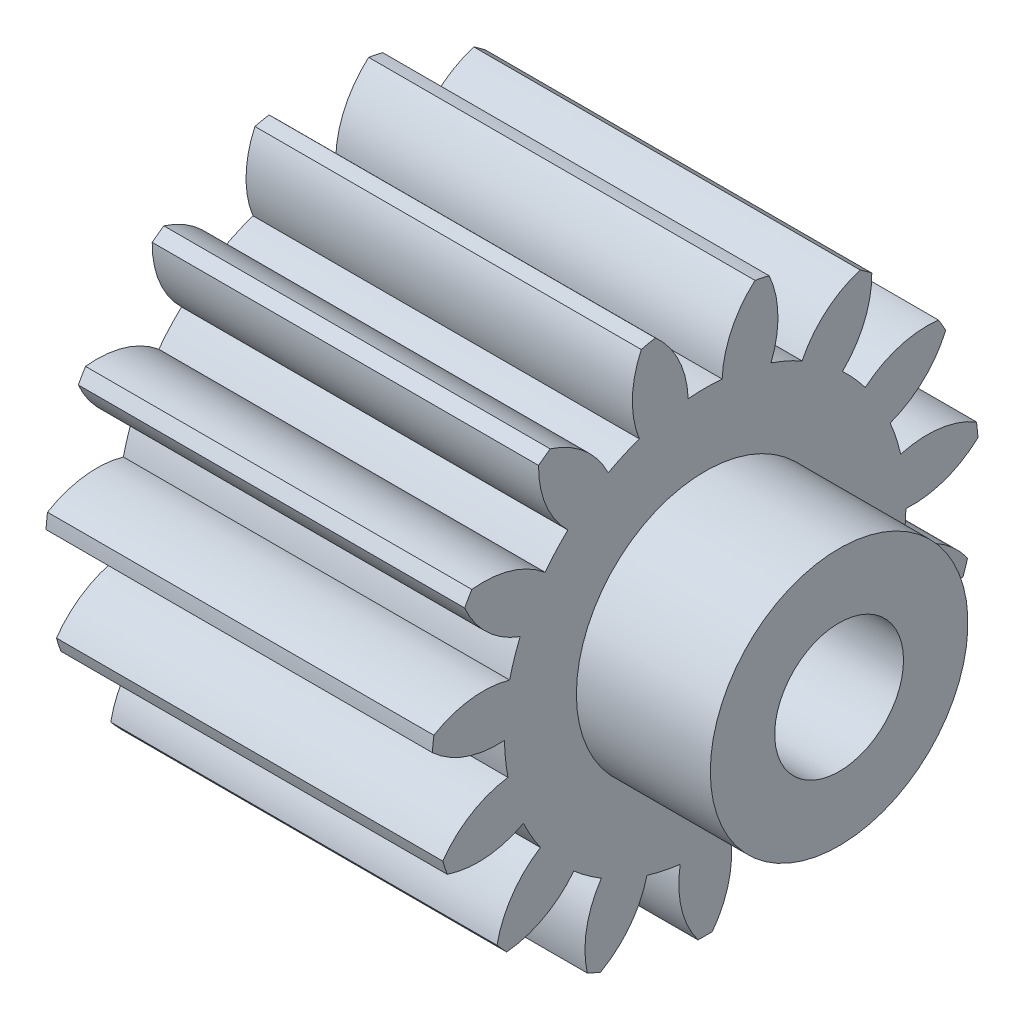
from build123d import *

# Parameters (mm, degrees)
SPUR_START             = -77.326171545
SPUR_GEAR_AI_OUTLINE_R = 1.5875
SPUR_GEAR_AI_DEPTH     = 9.525
SKETCH1_R              = 3.175
SKETCH1_R_2            = 1.5875
BOSS_EXTRUDE1_DEPTH    = 3.302


# Read off the part's stored shape, not the designer's step: spur gear_ai
with BuildPart() as part:
    # spur gear_ai outline → spur gear_ai (new body)
    with BuildSketch(Plane.YZ.offset(SPUR_START)):
        with BuildLine():
            ThreePointArc((25.700043696, 22.871890839), (25.806291245, 23.014153087), (25.908758385, 23.159161964))
            ThreePointArc((25.908758385, 23.159161964), (25.44365934, 24.001503635), (24.683177407, 24.591015164))
            ThreePointArc((24.683177407, 24.591015164), (24.869844856, 24.966591507), (25.024047568, 25.356622082))
            ThreePointArc((25.024047568, 25.356622082), (25.971001747, 25.185934076), (26.908195608, 25.40393472))
            ThreePointArc((26.908195608, 25.40393472), (26.947394305, 25.577112523), (26.982022272, 25.751261864))
            ThreePointArc((26.982022272, 25.751261864), (26.214521927, 26.331606447), (25.280011171, 26.560836158))
            ThreePointArc((25.280011171, 26.560836158), (25.297779711, 26.979866711), (25.280011171, 27.398897265))
            ThreePointArc((25.280011171, 27.398897265), (26.214521927, 27.628126976), (26.982022272, 28.208471559))
            ThreePointArc((26.982022272, 28.208471559), (26.947394305, 28.3826209), (26.908195608, 28.555798703))
            ThreePointArc((26.908195608, 28.555798703), (25.971001747, 28.773799347), (25.024047568, 28.60311134))
            ThreePointArc((25.024047568, 28.60311134), (24.869844856, 28.993141915), (24.683177407, 29.368718258))
            ThreePointArc((24.683177407, 29.368718258), (25.44365934, 29.958229787), (25.908758385, 30.800571458))
            ThreePointArc((25.908758385, 30.800571458), (25.806291245, 30.945580335), (25.700043696, 31.087842584))
            ThreePointArc((25.700043696, 31.087842584), (24.755205651, 30.905804997), (23.959545029, 30.36471278))
            ThreePointArc((23.959545029, 30.36471278), (23.660034115, 30.658303547), (23.336744253, 30.925485117))
            ThreePointArc((23.336744253, 30.925485117), (23.791703129, 31.773346565), (23.873981026, 32.732036797))
            ThreePointArc((23.873981026, 32.732036797), (23.721392211, 32.822831857), (23.566466975, 32.909580117))
            ThreePointArc((23.566466975, 32.909580117), (22.777355829, 32.358980252), (22.270565713, 31.541043584))
            ThreePointArc((22.270565713, 31.541043584), (21.877534755, 31.687430032), (21.473522236, 31.800018709))
            ThreePointArc((21.473522236, 31.800018709), (21.544291531, 32.759627129), (21.229521683, 33.668899671))
            ThreePointArc((21.229521683, 33.668899671), (21.053195187, 33.689781624), (20.876380246, 33.706016332))
            ThreePointArc((20.876380246, 33.706016332), (20.379440483, 32.882057908), (20.249149489, 31.92870547))
            ThreePointArc((20.249149489, 31.92870547), (19.83055711, 31.902576052), (19.415679368, 31.84110423))
            ThreePointArc((19.415679368, 31.84110423), (19.090022428, 32.746534609), (18.432631403, 33.449167979))
            ThreePointArc((18.432631403, 33.449167979), (18.263055677, 33.396526145), (18.09492394, 33.339440173))
            ThreePointArc((18.09492394, 33.339440173), (17.976080961, 32.384593086), (18.244817586, 31.460668176))
            ThreePointArc((18.244817586, 31.460668176), (17.873042211, 31.266540906), (17.519035377, 31.041637622))
            ThreePointArc((17.519035377, 31.041637622), (16.853261246, 31.736332821), (15.966917922, 32.110835325))
            ThreePointArc((15.966917922, 32.110835325), (15.833414151, 31.993771955), (15.703037123, 31.873235987))
            ThreePointArc((15.703037123, 31.873235987), (15.982839958, 30.952601973), (16.604137198, 30.217859601))
            ThreePointArc((16.604137198, 30.217859601), (16.343462167, 29.889300848), (16.111537238, 29.539853923))
            ThreePointArc((16.111537238, 29.539853923), (15.220764312, 29.903694832), (14.258725503, 29.885311585))
            ThreePointArc((14.258725503, 29.885311585), (14.184377702, 29.724068), (14.114298755, 29.560923799))
            ThreePointArc((14.114298755, 29.560923799), (14.744366952, 28.833688843), (15.610796869, 28.41517264))
            ThreePointArc((15.610796869, 28.41517264), (15.506295264, 28.008993196), (15.436554167, 27.595425178))
            ThreePointArc((15.436554167, 27.595425178), (14.474805177, 27.565500398), (13.603416133, 27.157410031))
            ThreePointArc((13.603416133, 27.157410031), (13.601079711, 26.979866712), (13.603416133, 26.802323392))
            ThreePointArc((13.603416133, 26.802323392), (14.474805177, 26.394233025), (15.436554167, 26.364308244))
            ThreePointArc((15.436554167, 26.364308244), (15.506295264, 25.950740226), (15.610796869, 25.544560783))
            ThreePointArc((15.610796869, 25.544560783), (14.744366952, 25.12604458), (14.114298755, 24.398809624))
            ThreePointArc((14.114298755, 24.398809624), (14.184377702, 24.235665423), (14.258725503, 24.074421838))
            ThreePointArc((14.258725503, 24.074421838), (15.220764312, 24.056038591), (16.111537238, 24.4198795))
            ThreePointArc((16.111537238, 24.4198795), (16.343462167, 24.070432575), (16.604137198, 23.741873821))
            ThreePointArc((16.604137198, 23.741873821), (15.982839958, 23.007131449), (15.703037123, 22.086497436))
            ThreePointArc((15.703037123, 22.086497436), (15.833414152, 21.965961467), (15.966917922, 21.848898097))
            ThreePointArc((15.966917922, 21.848898097), (16.853261246, 22.223400602), (17.519035377, 22.918095801))
            ThreePointArc((17.519035377, 22.918095801), (17.873042211, 22.693192517), (18.244817586, 22.499065247))
            ThreePointArc((18.244817586, 22.499065247), (17.976080961, 21.575140337), (18.09492394, 20.62029325))
            ThreePointArc((18.09492394, 20.62029325), (18.263055677, 20.563207278), (18.432631403, 20.510565444))
            ThreePointArc((18.432631403, 20.510565444), (19.090022428, 21.213198814), (19.415679368, 22.118629192))
            ThreePointArc((19.415679368, 22.118629192), (19.83055711, 22.057157371), (20.249149489, 22.031027953))
            ThreePointArc((20.249149489, 22.031027953), (20.379440483, 21.077675515), (20.876380246, 20.253717091))
            ThreePointArc((20.876380246, 20.253717091), (21.053195187, 20.269951799), (21.229521683, 20.290833751))
            ThreePointArc((21.229521683, 20.290833751), (21.544291531, 21.200106294), (21.473522236, 22.159714714))
            ThreePointArc((21.473522236, 22.159714714), (21.877534755, 22.272303391), (22.270565713, 22.418689838))
            ThreePointArc((22.270565713, 22.418689838), (22.777355829, 21.600753171), (23.566466975, 21.050153306))
            ThreePointArc((23.566466975, 21.050153306), (23.721392211, 21.136901565), (23.873981026, 21.227696625))
            ThreePointArc((23.873981026, 21.227696625), (23.791703129, 22.186386858), (23.336744253, 23.034248306))
            ThreePointArc((23.336744253, 23.034248306), (23.660034115, 23.301429876), (23.959545029, 23.595020643))
            ThreePointArc((23.959545029, 23.595020643), (24.755205651, 23.053928425), (25.700043696, 22.871890839))
        make_face()
        with Locations((20.347954711, 26.979866711)):
            Circle(SPUR_GEAR_AI_OUTLINE_R, mode=Mode.SUBTRACT)
    extrude(amount=SPUR_GEAR_AI_DEPTH)

    # Sketch1 → Boss-Extrude1 (add)
    with BuildSketch(Plane(origin=(-67.801171545, 0, 0), x_dir=(0, 0, -1), z_dir=(1, 0, 0))):
        with Locations(Location((-26.979866711, 20.347954711, 0), (0, 0, 180))):
            Circle(SKETCH1_R)
        with Locations((-26.979866711, 20.347954711)):
            Circle(SKETCH1_R_2, mode=Mode.SUBTRACT)
    extrude(amount=BOSS_EXTRUDE1_DEPTH)


solid = part.part
